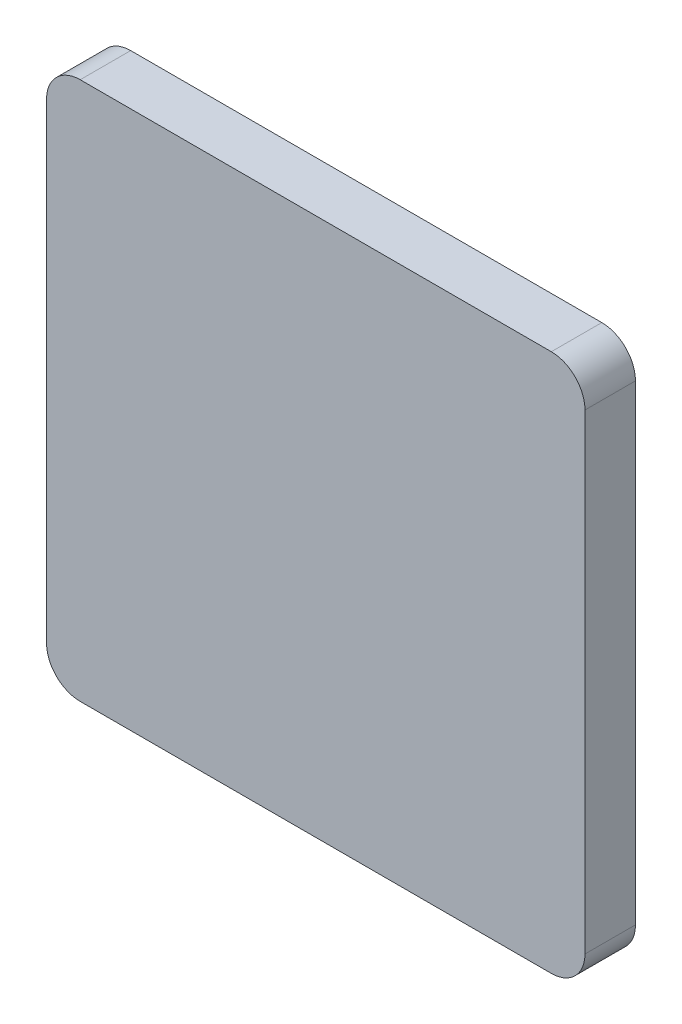
from build123d import *

# Parameters (mm, degrees)
CROQUIS1_W              = 32
CROQUIS1_H              = 32
SALIENTE_EXTRUIR1_DEPTH = 3
REDONDEO1_R             = 2


with BuildPart() as part:
    # Croquis1 → Saliente-Extruir1 (new body)
    with BuildSketch(Plane.XY):
        Rectangle(CROQUIS1_W, CROQUIS1_H)
    extrude(amount=SALIENTE_EXTRUIR1_DEPTH)

    # Redondeo1
    redondeo1_edges = [part.edges().sort_by_distance(p)[0] for p in [
        (16, -16, 1.5),
        (-16, -16, 1.5),
        (16, 16, 1.5),
        (-16, 16, 1.5),
    ]]
    fillet(redondeo1_edges, radius=REDONDEO1_R)


solid = part.part
